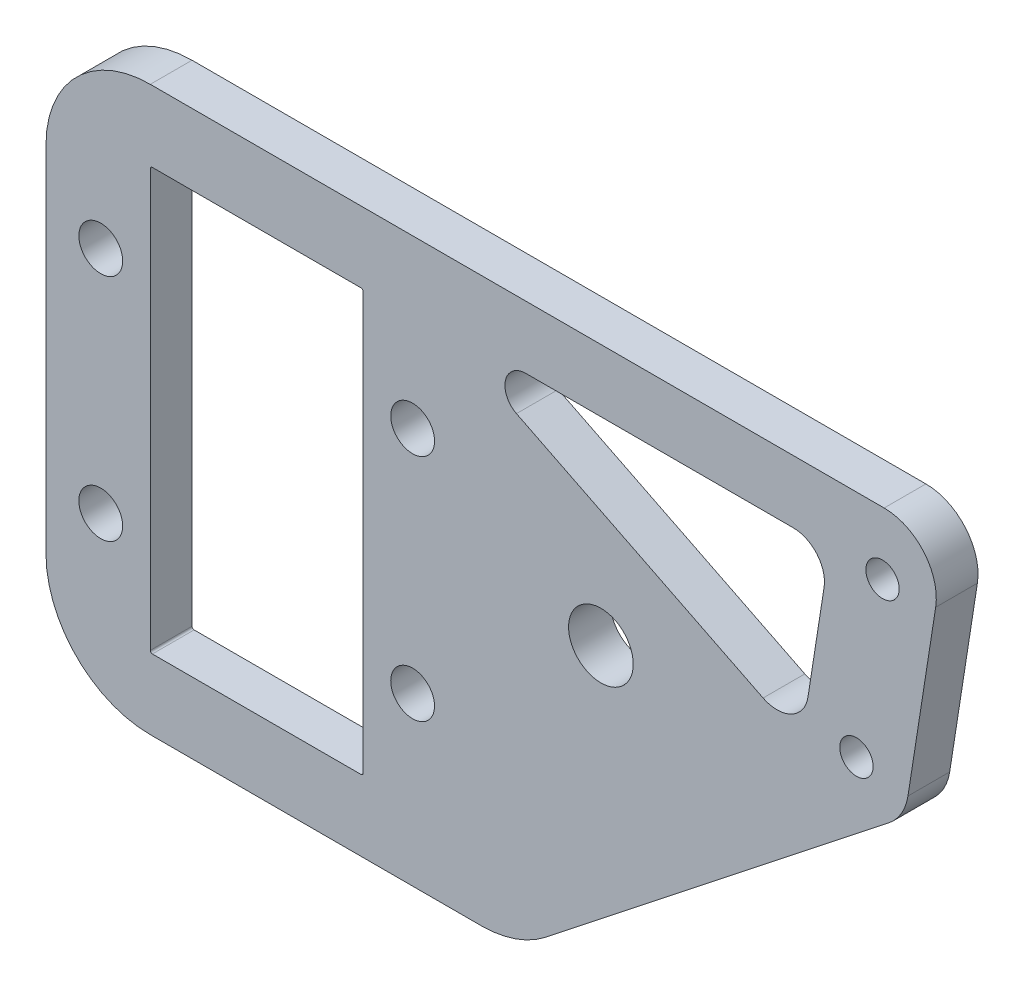
from build123d import *

# Parameters (mm, degrees)
SKETCH_1_R          = 3.1
SKETCH_1_R_2        = 1.6
SKETCH_1_W          = 20.4
SKETCH_1_H          = 40.4
EXTRUDE_1_DEPTH     = 4
FILLET_1_R          = 0.2
SKETCH_2_R          = 2.1
CUT_EXTRUDE_1_DEPTH = 4
CUT_EXTRUDE_2_DEPTH = 10


with BuildPart() as part:
    # 草图1 → 凸台-拉伸1 (new body)
    with BuildSketch(Plane.XY):
        with BuildLine():
            Line((-10.2, 27), (60.15625, 27))
            ThreePointArc((60.15625, 27), (63.954895943, 25.251198086), (65.096310169, 21.228115599))
            Line((65.096310169, 21.228115599), (62.440060169, 4.228115599))
            ThreePointArc((62.440060169, 4.228115599), (61.816569536, 2.476663431), (60.596300169, 1.074070141))
            Line((60.596300169, 1.074070141), (27.72371786, -24.851859719))
            ThreePointArc((27.72371786, -24.851859719), (24.808418455, -26.447713935), (21.531117522, -27))
            Line((21.531117522, -27), (-10.2, -27))
            ThreePointArc((-10.2, -27), (-17.271067812, -24.071067812), (-20.2, -17))
            Line((-20.2, -17), (-20.2, 17))
            ThreePointArc((-20.2, 17), (-17.271067812, 24.071067812), (-10.2, 27))
        make_face()
        with Locations((33, 2)):
            Circle(SKETCH_1_R, mode=Mode.SUBTRACT)
        with Locations((60, 21)):
            Circle(SKETCH_1_R_2, mode=Mode.SUBTRACT)
        with Locations((57.5, 5)):
            Circle(SKETCH_1_R_2, mode=Mode.SUBTRACT)
        Rectangle(SKETCH_1_W, SKETCH_1_H, mode=Mode.SUBTRACT)
    extrude(amount=EXTRUDE_1_DEPTH)

    # 圆角1
    fillet_1_edges = [part.edges().sort_by_distance(p)[0] for p in [
        (10.2, -20.2, 2),
        (-10.2, -20.2, 2),
        (-10.2, 20.2, 2),
        (10.2, 20.2, 2),
    ]]
    fillet(fillet_1_edges, radius=FILLET_1_R)

    # 草图2 → 切除-拉伸1 (cut)
    with BuildSketch(Plane.XY.offset(4)):
        with Locations((14.95, 11)):
            Circle(SKETCH_2_R)
        with Locations((14.95, -11)):
            Circle(SKETCH_2_R)
        with Locations((-14.95, -11)):
            Circle(SKETCH_2_R)
        with Locations((-14.95, 11)):
            Circle(SKETCH_2_R)
    extrude(amount=-CUT_EXTRUDE_1_DEPTH, mode=Mode.SUBTRACT)

    # 草图3 → 切除-拉伸2 (cut)
    with BuildSketch(Plane.XY.offset(4)):
        with BuildLine():
            Line((25.798016292, 21), (51.43418263, 21))
            ThreePointArc((51.43418263, 21), (53.713370196, 19.950718852), (54.398218731, 17.536869359))
            Line((54.398218731, 17.536869359), (52.852232934, 7.642560256))
            ThreePointArc((52.852232934, 7.642560256), (51.264559821, 5.440053089), (48.549531682, 5.420923567))
            Line((48.549531682, 5.420923567), (24.905572858, 17.210155114))
            ThreePointArc((24.905572858, 17.210155114), (23.851263897, 19.458426781), (25.798016292, 21))
        make_face()
    extrude(amount=-CUT_EXTRUDE_2_DEPTH, mode=Mode.SUBTRACT)


solid = part.part
